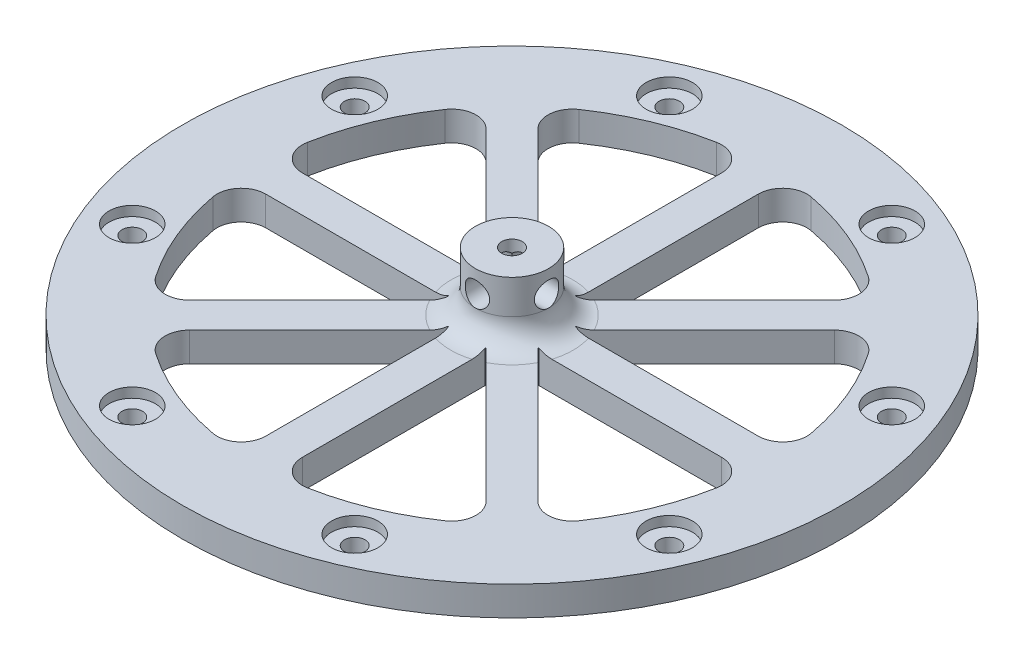
from build123d import *

# Parameters (mm, degrees)
SKETCH1_R           = 67.5
BOSS_EXTRUDE1_DEPTH = 3
SKETCH2_R           = 4.75
CUT_EXTRUDE1_DEPTH  = 2
SKETCH3_R           = 2.1
CUT_EXTRUDE2_DEPTH  = 4
SKETCH4_R           = 7.5
BOSS_EXTRUDE2_DEPTH = 12
SKETCH5_R           = 2.1
CUT_EXTRUDE3_DEPTH  = 18
FILLET3_START       = 3
FILLET3_2_DEPTH     = 5
SKETCH6_R           = 2.5
CUT_EXTRUDE4_DEPTH  = 10
FILLET2_R           = 5
SKETCH7_R           = 2.5
CUT_EXTRUDE5_DEPTH  = 10


with BuildPart() as part:
    # Sketch1 → Boss-Extrude1 (new, symmetric)
    with BuildSketch(Plane(origin=(0, 0, 0), x_dir=(1, 0, 0), z_dir=(0, 1, 0))):
        with Locations(Location((0, 0, 0), (0, 0, 270))):
            Circle(SKETCH1_R)
        with BuildLine():
            Line((3.75, 9.270248109), (3.75, 52.365900164))
            ThreePointArc((3.75, 52.365900164), (20.090880199, 48.503675457), (34.37663268, 39.679933538))
            Line((34.37663268, 39.679933538), (3.903404872, 9.206705731))
            ThreePointArc((3.903404872, 9.206705731), (3.826834324, 9.238795325), (3.75, 9.270248109))
        make_face(mode=Mode.SUBTRACT)
        with BuildLine():
            Line((-3.903404872, 9.206705731), (-34.37663268, 39.679933538))
            ThreePointArc((-34.37663268, 39.679933538), (-20.090880199, 48.503675457), (-3.75, 52.365900164))
            Line((-3.75, 52.365900164), (-3.75, 9.270248109))
            ThreePointArc((-3.75, 9.270248109), (-3.826834324, 9.238795325), (-3.903404872, 9.206705731))
        make_face(mode=Mode.SUBTRACT)
        with BuildLine():
            Line((-9.270248109, 3.75), (-52.365900164, 3.75))
            ThreePointArc((-52.365900164, 3.75), (-48.503675457, 20.090880199), (-39.679933538, 34.37663268))
            Line((-39.679933538, 34.37663268), (-9.206705731, 3.903404872))
            ThreePointArc((-9.206705731, 3.903404872), (-9.238795325, 3.826834324), (-9.270248109, 3.75))
        make_face(mode=Mode.SUBTRACT)
        with BuildLine():
            Line((-9.206705731, -3.903404872), (-39.679933538, -34.37663268))
            ThreePointArc((-39.679933538, -34.37663268), (-48.503675457, -20.090880199), (-52.365900164, -3.75))
            Line((-52.365900164, -3.75), (-9.270248109, -3.75))
            ThreePointArc((-9.270248109, -3.75), (-9.238795325, -3.826834324), (-9.206705731, -3.903404872))
        make_face(mode=Mode.SUBTRACT)
        with BuildLine():
            Line((-3.75, -9.270248109), (-3.75, -52.365900164))
            ThreePointArc((-3.75, -52.365900164), (-20.090880199, -48.503675457), (-34.37663268, -39.679933538))
            Line((-34.37663268, -39.679933538), (-3.903404872, -9.206705731))
            ThreePointArc((-3.903404872, -9.206705731), (-3.826834324, -9.238795325), (-3.75, -9.270248109))
        make_face(mode=Mode.SUBTRACT)
        with BuildLine():
            Line((3.903404872, -9.206705731), (34.37663268, -39.679933538))
            ThreePointArc((34.37663268, -39.679933538), (20.090880199, -48.503675457), (3.75, -52.365900164))
            Line((3.75, -52.365900164), (3.75, -9.270248109))
            ThreePointArc((3.75, -9.270248109), (3.826834324, -9.238795325), (3.903404872, -9.206705731))
        make_face(mode=Mode.SUBTRACT)
        with BuildLine():
            Line((9.270248109, -3.75), (52.365900164, -3.75))
            ThreePointArc((52.365900164, -3.75), (48.503675457, -20.090880199), (39.679933538, -34.37663268))
            Line((39.679933538, -34.37663268), (9.206705731, -3.903404872))
            ThreePointArc((9.206705731, -3.903404872), (9.238795325, -3.826834324), (9.270248109, -3.75))
        make_face(mode=Mode.SUBTRACT)
        with BuildLine():
            Line((9.206705731, 3.903404872), (39.679933538, 34.37663268))
            ThreePointArc((39.679933538, 34.37663268), (48.503675457, 20.090880199), (52.365900164, 3.75))
            Line((52.365900164, 3.75), (9.270248109, 3.75))
            ThreePointArc((9.270248109, 3.75), (9.238795325, 3.826834324), (9.206705731, 3.903404872))
        make_face(mode=Mode.SUBTRACT)
    extrude(amount=BOSS_EXTRUDE1_DEPTH, both=True)

    # Sketch2 → Cut-Extrude1 (cut)
    with BuildSketch(Plane(origin=(0, 3, 0), x_dir=(1, 0, 0), z_dir=(0, 1, 0))):
        with Locations(Location((-55, 22.781745931, 0), (0, 0, 270))):
            Circle(SKETCH2_R)
        with Locations(Location((-22.781745931, 55, 0), (0, 0, 270))):
            Circle(SKETCH2_R)
        with Locations(Location((22.781745931, 55, 0), (0, 0, 270))):
            Circle(SKETCH2_R)
        with Locations(Location((55, 22.781745931, 0), (0, 0, 270))):
            Circle(SKETCH2_R)
        with Locations(Location((55, -22.781745931, 0), (0, 0, 270))):
            Circle(SKETCH2_R)
        with Locations(Location((22.781745931, -55, 0), (0, 0, 270))):
            Circle(SKETCH2_R)
        with Locations(Location((-22.781745931, -55, 0), (0, 0, 270))):
            Circle(SKETCH2_R)
        with Locations(Location((-55, -22.781745931, 0), (0, 0, 270))):
            Circle(SKETCH2_R)
    extrude(amount=-CUT_EXTRUDE1_DEPTH, mode=Mode.SUBTRACT)

    # Sketch3 → Cut-Extrude2 (cut)
    with BuildSketch(Plane(origin=(0, 1, 0), x_dir=(1, 0, 0), z_dir=(0, 1, 0))):
        with Locations(Location((-55, 22.781745931, 0), (0, 0, 270))):
            Circle(SKETCH3_R)
        with Locations(Location((-22.781745931, 55, 0), (0, 0, 270))):
            Circle(SKETCH3_R)
        with Locations(Location((22.781745931, 55, 0), (0, 0, 270))):
            Circle(SKETCH3_R)
        with Locations(Location((55, 22.781745931, 0), (0, 0, 270))):
            Circle(SKETCH3_R)
        with Locations(Location((55, -22.781745931, 0), (0, 0, 270))):
            Circle(SKETCH3_R)
        with Locations(Location((22.781745931, -55, 0), (0, 0, 270))):
            Circle(SKETCH3_R)
        with Locations(Location((-22.781745931, -55, 0), (0, 0, 270))):
            Circle(SKETCH3_R)
        with Locations(Location((-55, -22.781745931, 0), (0, 0, 270))):
            Circle(SKETCH3_R)
    extrude(amount=-CUT_EXTRUDE2_DEPTH, mode=Mode.SUBTRACT)

    # Sketch4 → Boss-Extrude2 (add)
    with BuildSketch(Plane(origin=(0, 3, 0), x_dir=(1, 0, 0), z_dir=(0, 1, 0))):
        with Locations(Location((0, 0, 0), (0, 0, 270))):
            Circle(SKETCH4_R)
    extrude(amount=BOSS_EXTRUDE2_DEPTH)

    # Sketch5 → Cut-Extrude3 (cut)
    with BuildSketch(Plane(origin=(0, 15, 0), x_dir=(1, 0, 0), z_dir=(0, 1, 0))):
        with Locations(Location((0, 0, 0), (0, 0, 270))):
            Circle(SKETCH5_R)
    extrude(amount=-CUT_EXTRUDE3_DEPTH, mode=Mode.SUBTRACT)

    # Fillet3: read off the stored shape, not the designer's step
    # Fillet3 outline → Fillet3 (revolve)
    with BuildSketch(Plane.XY):
        with BuildLine():
            ThreePointArc((12.5, 3), (8.964466094, 4.464466094), (7.5, 8))
            Line((7.5, 8), (7.5, 3))
            Line((7.5, 3), (12.5, 3))
        make_face()
    revolve(axis=Axis((0, 0, 0), (0, 1, 0)))

    # Fillet3 2 outline → Fillet3 2 (cut)
    with BuildSketch(Plane(origin=(0, 0, 0), x_dir=(1, 0, 0), z_dir=(0, 1, 0)).offset(FILLET3_START)):
        with BuildLine():
            ThreePointArc((5.780060548, 11.083361406), (4.783542905, 11.548494156), (3.75, 11.924240018))
            Line((3.75, 11.924240018), (3.75, 9.270248109))
            ThreePointArc((3.75, 9.270248109), (3.826834324, 9.238795325), (3.903404872, 9.206705731))
            Line((3.903404872, 9.206705731), (5.780060548, 11.083361406))
        make_face()
        with BuildLine():
            Line((11.924240018, -3.75), (9.270248109, -3.75))
            ThreePointArc((9.270248109, -3.75), (9.238795325, -3.826834324), (9.206705731, -3.903404872))
            Line((9.206705731, -3.903404872), (11.083361406, -5.780060548))
            ThreePointArc((11.083361406, -5.780060548), (11.548494156, -4.783542905), (11.924240018, -3.75))
        make_face()
        with BuildLine():
            Line((5.780060548, -11.083361406), (3.903404872, -9.206705731))
            ThreePointArc((3.903404872, -9.206705731), (3.826834324, -9.238795325), (3.75, -9.270248109))
            Line((3.75, -9.270248109), (3.75, -11.924240018))
            ThreePointArc((3.75, -11.924240018), (4.783542905, -11.548494156), (5.780060548, -11.083361406))
        make_face()
        with BuildLine():
            Line((-3.75, -11.924240018), (-3.75, -9.270248109))
            ThreePointArc((-3.75, -9.270248109), (-3.826834324, -9.238795325), (-3.903404872, -9.206705731))
            Line((-3.903404872, -9.206705731), (-5.780060548, -11.083361406))
            ThreePointArc((-5.780060548, -11.083361406), (-4.783542905, -11.548494156), (-3.75, -11.924240018))
        make_face()
        with BuildLine():
            Line((-11.083361406, -5.780060548), (-9.206705731, -3.903404872))
            ThreePointArc((-9.206705731, -3.903404872), (-9.238795325, -3.826834324), (-9.270248109, -3.75))
            Line((-9.270248109, -3.75), (-11.924240018, -3.75))
            ThreePointArc((-11.924240018, -3.75), (-11.548494156, -4.783542905), (-11.083361406, -5.780060548))
        make_face()
        with BuildLine():
            ThreePointArc((-11.083361406, 5.780060548), (-11.548494156, 4.783542905), (-11.924240018, 3.75))
            Line((-11.924240018, 3.75), (-9.270248109, 3.75))
            ThreePointArc((-9.270248109, 3.75), (-9.238795325, 3.826834324), (-9.206705731, 3.903404872))
            Line((-9.206705731, 3.903404872), (-11.083361406, 5.780060548))
        make_face()
        with BuildLine():
            ThreePointArc((-3.75, 11.924240018), (-4.783542905, 11.548494156), (-5.780060548, 11.083361406))
            Line((-5.780060548, 11.083361406), (-3.903404872, 9.206705731))
            ThreePointArc((-3.903404872, 9.206705731), (-3.826834324, 9.238795325), (-3.75, 9.270248109))
            Line((-3.75, 9.270248109), (-3.75, 11.924240018))
        make_face()
        with BuildLine():
            ThreePointArc((11.924240018, 3.75), (11.548494156, 4.783542905), (11.083361406, 5.780060548))
            Line((11.083361406, 5.780060548), (9.206705731, 3.903404872))
            ThreePointArc((9.206705731, 3.903404872), (9.238795325, 3.826834324), (9.270248109, 3.75))
            Line((9.270248109, 3.75), (11.924240018, 3.75))
        make_face()
    extrude(amount=FILLET3_2_DEPTH, mode=Mode.SUBTRACT)

    # Sketch6 → Cut-Extrude4 (cut, symmetric)
    with BuildSketch(Plane(origin=(0, 0, 0), x_dir=(0, 0, -1), z_dir=(1, 0, 0))):
        with Locations(Location((0, 10.5, 0), (0, 0, 270))):
            Circle(SKETCH6_R)
    extrude(amount=CUT_EXTRUDE4_DEPTH, both=True, mode=Mode.SUBTRACT)

    # Fillet2
    fillet2_edges = [part.edges().sort_by_distance(p)[0] for p in [
        (39.679933538, 0, 34.37663268),
        (52.365900164, 0, 3.75),
        (-52.365900164, 0, 3.75),
        (-39.679933538, 0, 34.37663268),
        (-3.75, 0, -52.365900164),
        (-34.37663268, 0, -39.679933538),
        (-39.679933538, 0, -34.37663268),
        (-52.365900164, 0, -3.75),
        (-34.37663268, 0, 39.679933538),
        (-3.75, 0, 52.365900164),
        (3.75, 0, 52.365900164),
        (34.37663268, 0, 39.679933538),
        (52.365900164, 0, -3.75),
        (39.679933538, 0, -34.37663268),
        (34.37663268, 0, -39.679933538),
        (3.75, 0, -52.365900164),
    ]]
    fillet(fillet2_edges, radius=FILLET2_R)

    # Sketch7 → Cut-Extrude5 (cut, symmetric)
    with BuildSketch(Plane.XY):
        with Locations(Location((0, 10.5, 0), (0, 0, 53.560619548))):
            Circle(SKETCH7_R)
    extrude(amount=CUT_EXTRUDE5_DEPTH, both=True, mode=Mode.SUBTRACT)


solid = part.part
